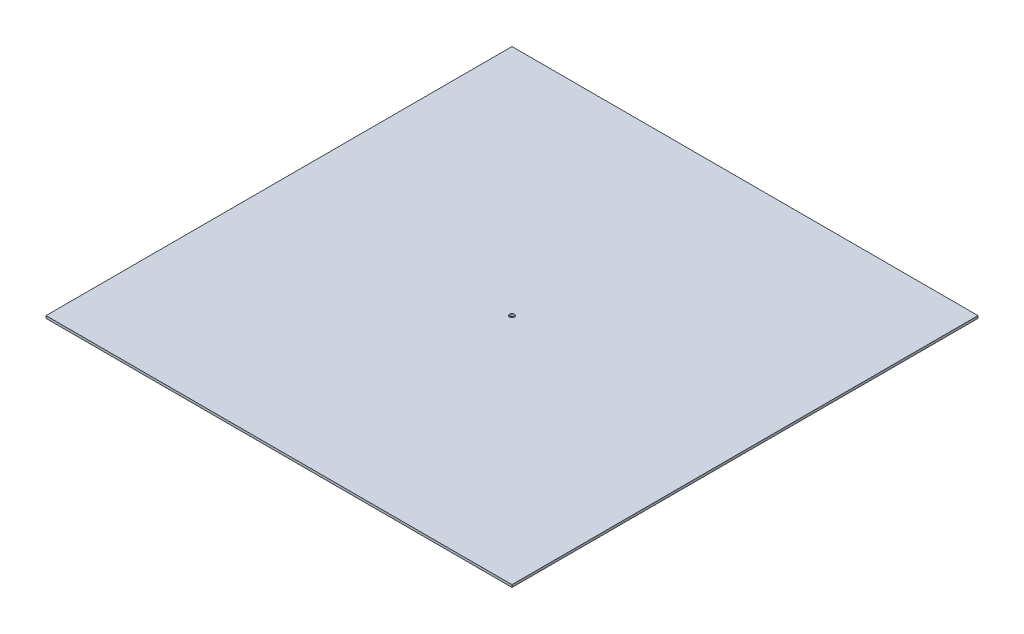
from build123d import *

# Parameters (mm, degrees)
SKETCH1_W           = 4826
SKETCH1_H           = 4826
BOSS_EXTRUDE1_DEPTH = 25.4
SKETCH2_R           = 25.4
CUT_EXTRUDE1_DEPTH  = 3413.591853709


with BuildPart() as part:
    # Sketch1 → Boss-Extrude1 (new body)
    with BuildSketch(Plane(origin=(0, 0, 0), x_dir=(1, 0, 0), z_dir=(0, 1, 0))):
        Rectangle(SKETCH1_W, SKETCH1_H)
    extrude(amount=BOSS_EXTRUDE1_DEPTH)

    # Sketch2 → Cut-Extrude1 (cut, through all)
    with BuildSketch(Plane.XZ):
        Circle(SKETCH2_R)
    extrude(amount=-CUT_EXTRUDE1_DEPTH, mode=Mode.SUBTRACT)


solid = part.part
